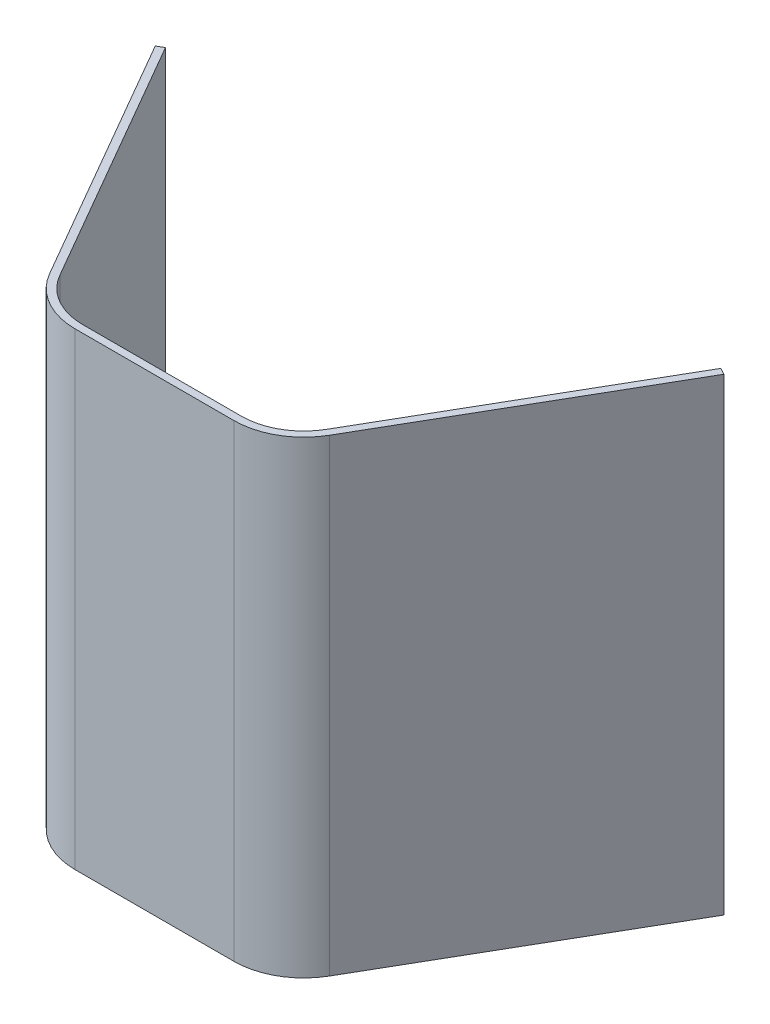
from build123d import *

# Parameters (mm, degrees)
BOSS_EXTRU_1_DEPTH = 75


with BuildPart() as part:
    # Esquisse1 → Boss.-Extru.1 (new body)
    with BuildSketch(Plane(origin=(0, 0, 0), x_dir=(1, 0, 0), z_dir=(0, 1, 0))):
        with BuildLine():
            Line((-45.518615231, 77.640554271), (-22.401190445, 37.6))
            ThreePointArc((-22.401190445, 37.6), (-18.301705922, 33.500515478), (-12.701705922, 32))
            Line((-12.701705922, 32), (12.701705922, 32))
            ThreePointArc((12.701705922, 32), (18.301705922, 33.500515478), (22.401190445, 37.6))
            Line((22.401190445, 37.6), (45.518615231, 77.640554271))
            Line((45.518615231, 77.640554271), (44.479384747, 78.240554271))
            Line((44.479384747, 78.240554271), (21.36195996, 38.2))
            ThreePointArc((21.36195996, 38.2), (17.701705922, 34.539745962), (12.701705922, 33.2))
            Line((12.701705922, 33.2), (-12.701705922, 33.2))
            ThreePointArc((-12.701705922, 33.2), (-17.701705922, 34.539745962), (-21.36195996, 38.2))
            Line((-21.36195996, 38.2), (-44.479384747, 78.240554271))
            Line((-44.479384747, 78.240554271), (-45.518615231, 77.640554271))
        make_face()
    extrude(amount=BOSS_EXTRU_1_DEPTH)


solid = part.part
